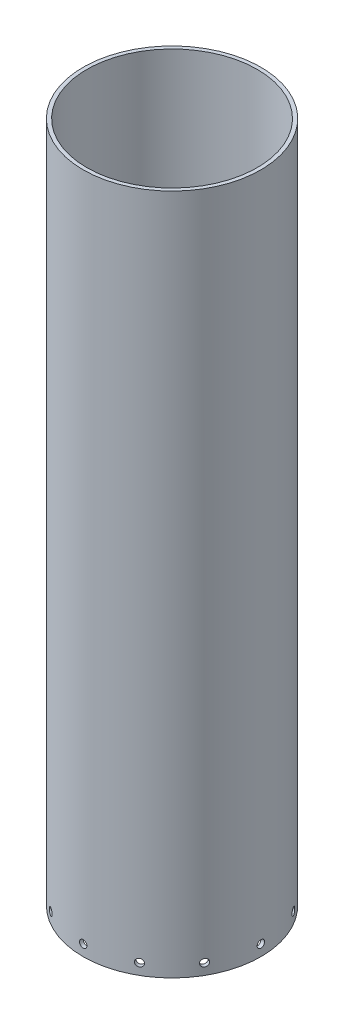
from build123d import *

# Parameters (mm, degrees)
SKETCH2_R           = 76.2
SKETCH2_R_2         = 73.025
BOSS_EXTRUDE1_DEPTH = 584.2
SKETCH3_R           = 3.175
CUT_EXTRUDE1_DEPTH  = 595.055990627
CIRPATTERN1_COUNT   = 12


with BuildPart() as part:
    # Sketch2 → Boss-Extrude1 (new body)
    with BuildSketch(Plane(origin=(0, 0, 0), x_dir=(1, 0, 0), z_dir=(0, 1, 0))):
        Circle(SKETCH2_R)
        Circle(SKETCH2_R_2, mode=Mode.SUBTRACT)
    extrude(amount=BOSS_EXTRUDE1_DEPTH)

    # Sketch3 → Cut-Extrude1 (cut, through all)
    with BuildSketch(Plane.XY):
        with Locations((0, 9.525)):
            Circle(SKETCH3_R)
    cut_extrude1 = extrude(amount=-CUT_EXTRUDE1_DEPTH, mode=Mode.SUBTRACT)

    # CirPattern1: Cut-Extrude1 ×12 about axis
    cirpattern1_axis = Axis((0, 0, 0), (0, 1, 0))
    for i in range(1, CIRPATTERN1_COUNT):
        add(cut_extrude1.rotate(cirpattern1_axis, i * 360 / CIRPATTERN1_COUNT), mode=Mode.SUBTRACT)


solid = part.part
